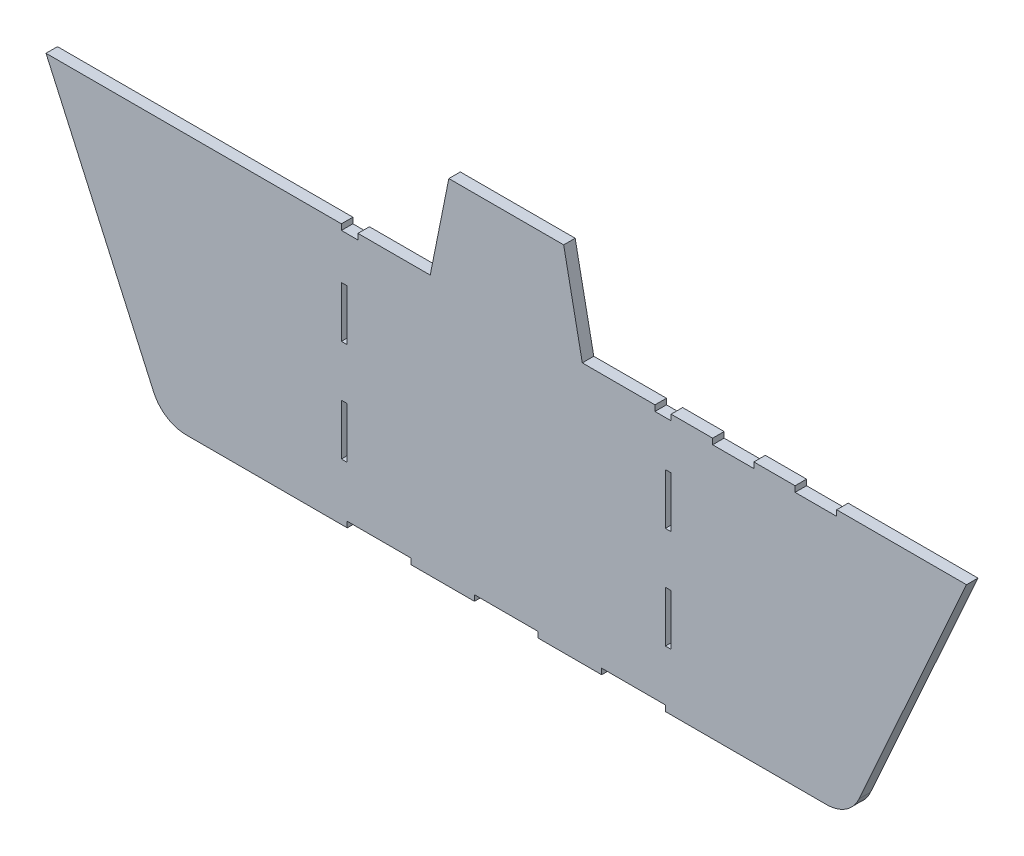
from build123d import *

# Parameters (mm, degrees)
BOSS_EXTRUDE1_DEPTH      = 20.32
CUT_EXTRUDE1_START       = -20.32
CUT_EXTRUDE1_OUTLINE_W   = 112.522
CUT_EXTRUDE1_OUTLINE_H   = 10.16
CUT_EXTRUDE1_OUTLINE_W_2 = 112.4712
CUT_EXTRUDE1_DEPTH       = 20.32
SKETCH3_W                = 10.166490401
SKETCH3_H                = 90.17
SKETCH3_W_2              = 29.273269095
SKETCH3_H_2              = 10.16
SKETCH3_W_3              = 28.575
CUT_EXTRUDE2_DEPTH       = 1125.982


# Read off the part's stored shape, not the designer's step: Cut-Extrude1
with BuildPart() as part:
    # Sketch1 → Boss-Extrude1 (new body)
    with BuildSketch(Plane.XY):
        Polygon((1595.466660195, 3031.488204655), (1326.388576611, 3031.488204655), (1359.327618403, 3195.873483514), (1562.527618403, 3195.873483514), align=None)
        with BuildLine():
            Line((894.428066471, 2570.722953846), (2027.427046989, 2570.722953846))
            add(Edge.make_bspline(
                [(2085.030207364, 2608.219614395), (2082.704936523, 2602.979434666), (2079.555914944, 2597.842123597), (2071.701679737, 2588.506915395), (2066.997802899, 2584.31975945), (2056.553975566, 2577.521356648), (2050.823670006, 2574.916388157), (2039.117489861, 2571.518756347), (2033.151956819, 2570.722953846), (2027.427046989, 2570.722953846)],
                knots=[0, 0, 0, 0, 0.25, 0.25, 0.5, 0.5, 0.75, 0.75, 1, 1, 1, 1], degree=3))
            Line((2085.030207364, 2608.219614395), (2275.234550162, 3031.488204655))
            Line((2275.234550162, 3031.488204655), (646.620686644, 3031.488204655))
            Line((646.620686644, 3031.488204655), (836.825029442, 2608.219614395))
            add(Edge.make_bspline(
                [(836.825029442, 2608.219614395), (839.150300283, 2602.979434666), (842.299321863, 2597.842123597), (850.153557069, 2588.506915395), (854.857433907, 2584.31975945), (865.30126124, 2577.521356648), (871.0315668, 2574.916388157), (882.737746945, 2571.518756347), (888.703279987, 2570.722953846), (894.428066471, 2570.722953846)],
                knots=[0, 0, 0, 0, 0.25, 0.25, 0.5, 0.5, 0.75, 0.75, 1, 1, 1, 1], degree=3))
        make_face()
    extrude(amount=BOSS_EXTRUDE1_DEPTH)

    # Cut-Extrude1 outline → Cut-Extrude1 (cut)
    with BuildSketch(Plane.XY.offset(20.32).offset(CUT_EXTRUDE1_START)):
        Polygon((1629.735958734, 2580.882920539), (1629.73595673, 2570.722953846), (1742.25795673, 2570.722953846), (1742.257958734, 2580.882898338), align=None)
        with Locations((1235.85815673, 2575.802953846)):
            Rectangle(CUT_EXTRUDE1_OUTLINE_W, CUT_EXTRUDE1_OUTLINE_H)
        with Locations((1460.92755673, 2575.802953846)):
            Rectangle(CUT_EXTRUDE1_OUTLINE_W_2, CUT_EXTRUDE1_OUTLINE_H)
    extrude(amount=CUT_EXTRUDE1_DEPTH, mode=Mode.SUBTRACT)

    # Sketch3 → Cut-Extrude2 (cut)
    with BuildSketch(Plane(origin=(0, 0, 0), x_dir=(-1, 0, 0), z_dir=(0, 0, -1))):
        with Locations((-1174.33046881, 2716.137953846)):
            Rectangle(SKETCH3_W, SKETCH3_H)
        with Locations((-1174.33046881, 2896.477953846)):
            Rectangle(SKETCH3_W, SKETCH3_H)
        with Locations((-1183.883858158, 3026.408204655)):
            Rectangle(SKETCH3_W_2, SKETCH3_H_2)
        with Locations((-1738.320389849, 3026.408204655)):
            Rectangle(SKETCH3_W_3, SKETCH3_H_2)
        with Locations((-1747.524644649, 2896.477953846)):
            Rectangle(SKETCH3_W, SKETCH3_H)
        with Locations((-1747.524644649, 2716.137953846)):
            Rectangle(SKETCH3_W, SKETCH3_H)
        Polygon((-1826.076531052, 3021.328204655), (-1826.099732345, 3031.488204655), (-1899.001104211, 3031.488204655), (-1899.001104211, 3021.328204655), align=None)
        Polygon((-2045.548278228, 3031.488204655), (-2045.548278228, 3021.328204655), (-1971.92567737, 3021.328204655), (-1971.948878664, 3031.488204655), align=None)
    extrude(amount=-CUT_EXTRUDE2_DEPTH, mode=Mode.SUBTRACT)


solid = part.part
